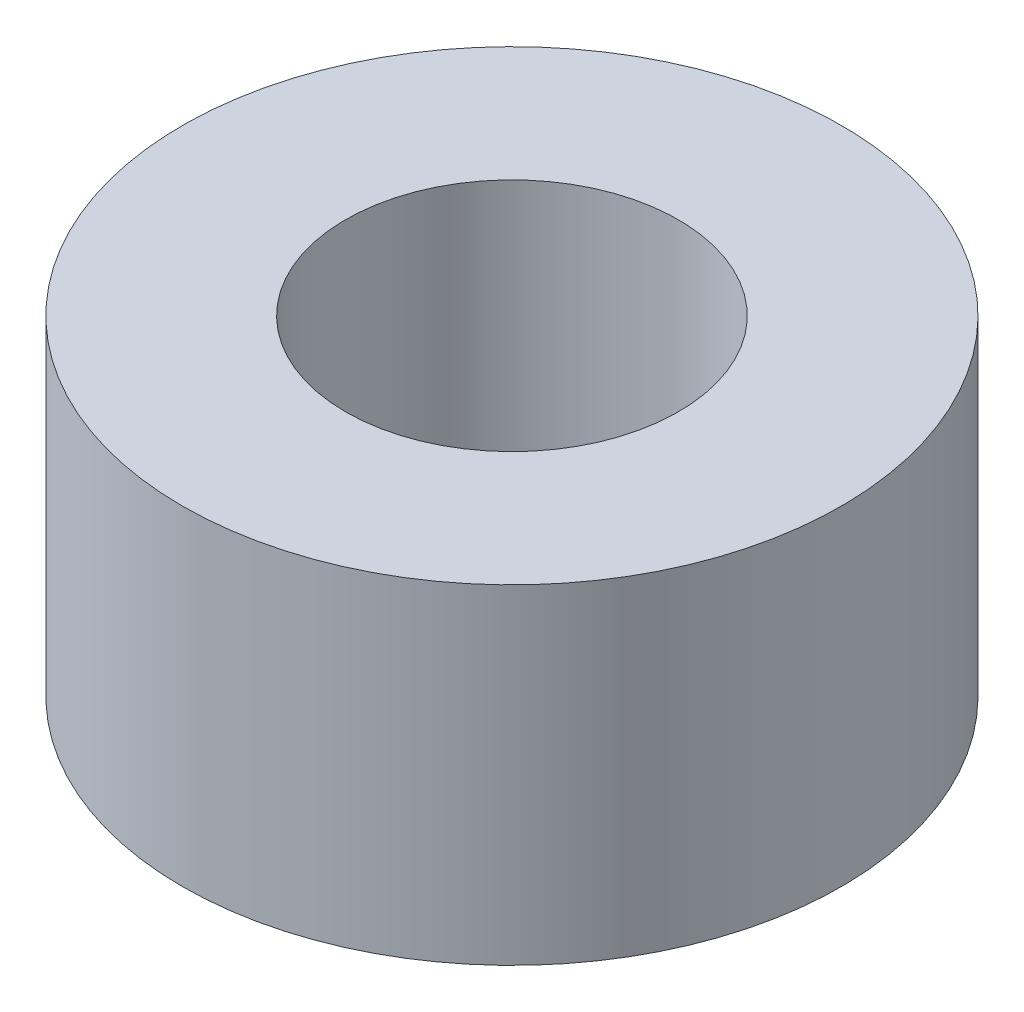
from build123d import *

# Parameters (mm, degrees)
SKETCH_1_R      = 5
SKETCH_1_R_2    = 2.525
EXTRUDE_1_DEPTH = 2.5


with BuildPart() as part:
    # ｽｹｯﾁ1 → ﾎﾞｽ - 押し出し1 (new, symmetric)
    with BuildSketch(Plane(origin=(0, 0, 0), x_dir=(1, 0, 0), z_dir=(0, 1, 0))):
        Circle(SKETCH_1_R)
        Circle(SKETCH_1_R_2, mode=Mode.SUBTRACT)
    extrude(amount=EXTRUDE_1_DEPTH, both=True)


solid = part.part
